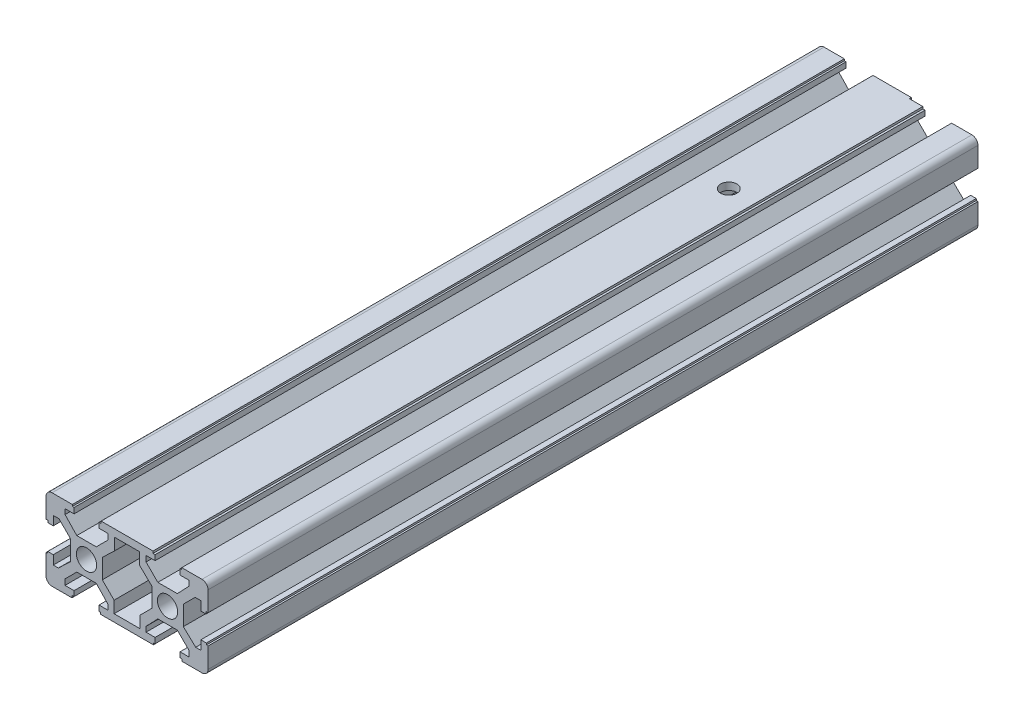
from build123d import *
from OCP.BRepAlgoAPI import BRepAlgoAPI_Cut
from OCP.TopTools import TopTools_ListOfShape

# Parameters (mm, degrees)
SKETCH1_R           = 2.5
BOSS_EXTRUDE1_DEPTH = 190.5
FILLET1_R           = 1.5
SKETCH2_W           = 16.94037733
SKETCH2_H           = 0.5
CUT_EXTRUDE1_DEPTH  = 23
SKETCH3_R           = 2
CUT_EXTRUDE2_DEPTH  = 23


with BuildPart() as part:
    # Sketch1 → Boss-Extrude1 (new body)
    with BuildSketch(Plane.XY):
        Polygon((-1.499992211, 10), (2.38e-06, 10), (1.500001785, 10), (6.400001785, 10), (6.400001785, 9.479132912), (6.925001785, 9.479132912), (6.925001785, 8.2), (4.695347664, 8.2), (4.695347664, 6.8), (7.595347664, 3.9), (12.404655907, 3.9), (15.304655907, 6.94037733), (15.304655907, 8.199999348), (13.075001785, 8.199999348), (13.075001785, 9.565762703), (13.497472172, 9.573136951), (13.497472172, 9.999999348), (18.397472172, 9.999999348), (20.000001785, 10), (20.000001785, 8.503508491), (20.000001785, 8.500000005), (20.000001785, 3.600001911), (19.479137611, 3.600002038), (19.479137484, 3.075002038), (18.200004571, 3.075002348), (18.200005113, 5.30465647), (16.800005113, 5.30465681), (13.900004408, 2.404657514), (13.900003241, -2.404650729), (16.940379867, -5.304651467), (18.200002536, -5.304651773), (18.200003078, -3.074997652), (19.565766433, -3.074997983), (19.573140578, -3.497468372), (20.000002975, -3.497468476), (20.000001785, -8.397468476), (20.000001785, -10), (18.500003987, -10), (13.600003987, -9.99999881), (13.600004114, -9.479131722), (13.075004114, -9.479131595), (13.075004424, -8.199998683), (15.304655907, -8.199999224), (15.304655907, -6.8), (12.404655907, -3.9), (7.595347664, -3.9), (4.695347664, -6.94037733), (4.695347664, -8.2), (6.925001785, -8.2), (6.925001785, -9.565763355), (6.502531399, -9.573137603), (6.502531399, -10), (1.602531399, -10), (2.38e-06, -10), (-1.602527233, -10), (-6.502525798, -10), (-6.502525798, -9.573137078), (-6.92499762, -9.565763355), (-6.92499762, -8.2), (-4.695343498, -8.2), (-4.695343498, -6.94037733), (-7.595343498, -3.9), (-12.404651741, -3.9), (-15.304651741, -6.8), (-15.304651741, -8.2), (-13.07499762, -8.2), (-13.07499762, -9.479132912), (-13.600001017, -9.479132912), (-13.600001017, -10), (-18.49999954, -10), (-19.99999762, -10), (-19.99999762, -3.497471822), (-19.573134698, -3.497471822), (-19.565760974, -3.075), (-18.19999762, -3.075), (-18.19999762, -5.304654122), (-16.94037495, -5.304654122), (-13.89999762, -2.404654122), (-13.89999762, 2.404654122), (-16.79999762, 5.304654122), (-18.19999762, 5.304654122), (-18.19999762, 3.075), (-19.479130532, 3.075), (-19.479130532, 3.600003398), (-19.99999762, 3.600003398), (-19.99999762, 10), (-13.497469442, 10), (-13.497469442, 9.573137078), (-13.07499762, 9.565763355), (-13.07499762, 8.2), (-15.304651741, 8.2), (-15.304651741, 6.94037733), (-12.404651741, 3.9), (-7.595343498, 3.9), (-4.695343498, 6.8), (-4.695343498, 8.2), (-6.92499762, 8.2), (-6.92499762, 9.479132912), (-6.399994222, 9.479132912), (-6.399994222, 10), align=None)
        with Locations((-9.99999762, 0)):
            Circle(SKETCH1_R, mode=Mode.SUBTRACT)
        with Locations(Location((9.99999762, 0, 0), (0, 0, 180))):
            Circle(SKETCH1_R, mode=Mode.SUBTRACT)
        Polygon((-3.059620289, 5.304654122), (-3.059620289, 8.2), (2.38e-06, 8.2), (3.059624455, 8.2), (3.059624455, 5.304654122), (6.100001785, 2.404654122), (6.100001785, -2.404654122), (3.200001785, -5.304654122), (3.200001785, -8.2), (2.38e-06, -8.2), (-3.19999762, -8.2), (-3.19999762, -5.304654122), (-6.09999762, -2.404654122), (-6.09999762, 2.404654122), align=None, mode=Mode.SUBTRACT)
    extrude(amount=-BOSS_EXTRUDE1_DEPTH)

    # Fillet1
    fillet1_edges = [part.edges().sort_by_distance(p)[0] for p in [
        (20.000001785, 10, -95.25),
        (20.000001785, -10, -95.25),
        (-19.99999762, -10, -95.25),
        (-19.99999762, 10, -95.25),
    ]]
    fillet(fillet1_edges, radius=FILLET1_R - 0.0001)  # a hair under: the kernel refuses the full size


with BuildPart() as cut_extrude1_tool:
    # Sketch2 → Cut-Extrude1 (new body)
    with BuildSketch(Plane(origin=(0, 10, 0), x_dir=(1, 0, 0), z_dir=(0, 1, 0))):
        with Locations((11.52981312, 190.25)):
            Rectangle(SKETCH2_W, SKETCH2_H)
    extrude(amount=-CUT_EXTRUDE1_DEPTH)


with BuildPart() as part_1:
    add(part.part)

    # Cut-Extrude1: cut by cut_extrude1_tool, with a tolerance
    cut_extrude1_stock = TopTools_ListOfShape()
    cut_extrude1_stock.Append(part_1.part.wrapped)
    cut_extrude1_tools = TopTools_ListOfShape()
    cut_extrude1_tools.Append(cut_extrude1_tool.part.wrapped)
    cut_extrude1_cut = BRepAlgoAPI_Cut()
    cut_extrude1_cut.SetArguments(cut_extrude1_stock)
    cut_extrude1_cut.SetTools(cut_extrude1_tools)
    cut_extrude1_cut.SetFuzzyValue(0.00001)
    cut_extrude1_cut.Build()
    add(Compound.cast(cut_extrude1_cut.Shape()).solids(), mode=Mode.REPLACE)

    # Sketch3 → Cut-Extrude2 (cut)
    with BuildSketch(Plane.XZ.offset(10)):
        with Locations(Location((2.8e-06, -148.5, 0), (0, 0, 270))):
            Circle(SKETCH3_R)
    extrude(amount=-CUT_EXTRUDE2_DEPTH, mode=Mode.SUBTRACT)


solid = part_1.part
